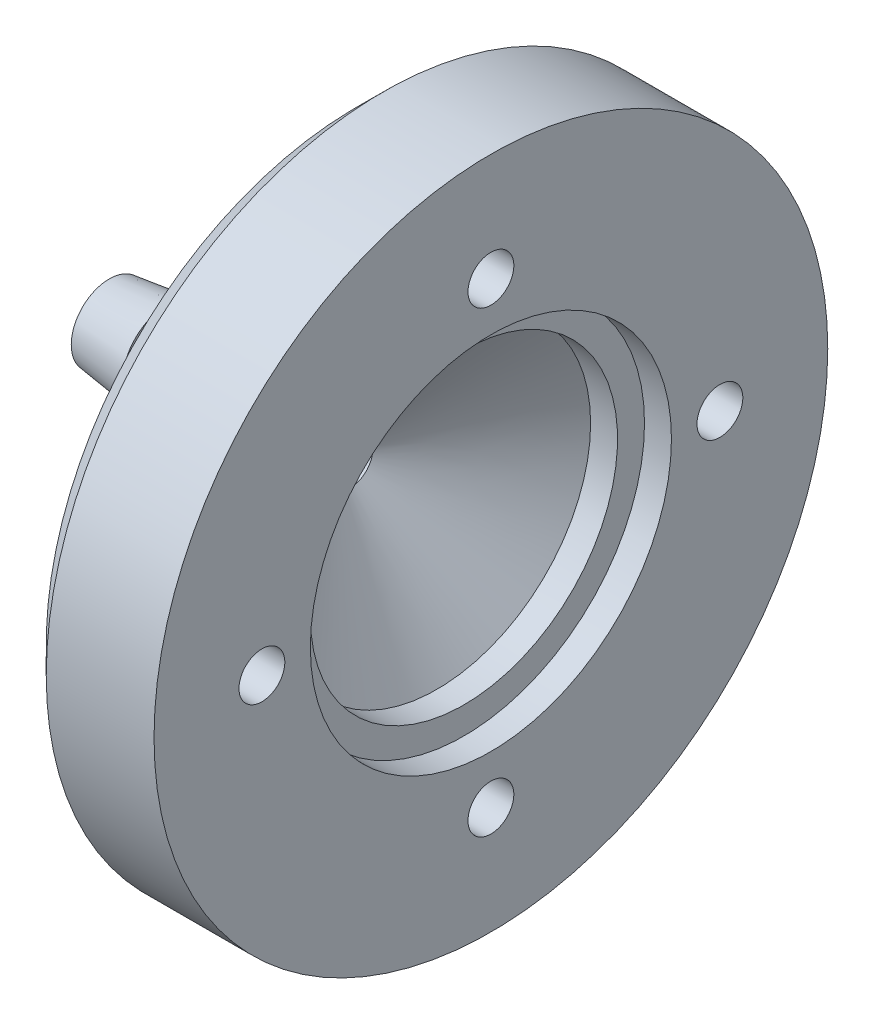
from build123d import *

# Parameters (mm, degrees)
M3_CLEARANCE_HOLE1_D     = 3.4
M3_CLEARANCE_HOLE1_DEPTH = 10
M3_CLEARANCE_HOLE1_TIP   = 1.021463052
CHAMFER1_SIZE            = 2


with BuildPart() as part:
    # Sketch1 → Revolve17 (revolve)
    with BuildSketch(Plane.XY):
        Polygon((-13.545647488, 3.375), (-13.545647488, 2.82), (-9.212314154, 3.375), (-9.212314154, 2.82), (-4.878980821, 3.375), (0.444201968, 11.4), (0.444201968, 25), (10.444201968, 25), (10.444201968, 13.4), (8.444201968, 13.4), (8.444201968, 11.4), (6.444201968, 11.4), (0, 1.685), (-17.878980821, 1.685), (-17.878980821, 2.82), align=None)
    revolve(axis=Axis((-801.920554309, 0, 0), (1, 0, 0)))

    # M3 Clearance Hole1
    with Locations(Plane.ZY.offset(-0.444201968)):
        with Locations((0, -16.994664238), (0, 16.994664238), (16.994664238, 0), (-16.994664238, 0)):
            Hole(M3_CLEARANCE_HOLE1_D / 2, depth=M3_CLEARANCE_HOLE1_DEPTH)
            with Locations((0, 0, -(M3_CLEARANCE_HOLE1_DEPTH + M3_CLEARANCE_HOLE1_TIP / 2))):  # 118° drill point
                Cone(0, M3_CLEARANCE_HOLE1_D / 2, M3_CLEARANCE_HOLE1_TIP, mode=Mode.SUBTRACT)

    # Chamfer1
    chamfer1_edges = [part.edges().sort_by_distance(p)[0] for p in [
        (0.444201968, -25, 0),
    ]]
    chamfer(chamfer1_edges, length=CHAMFER1_SIZE)


solid = part.part
